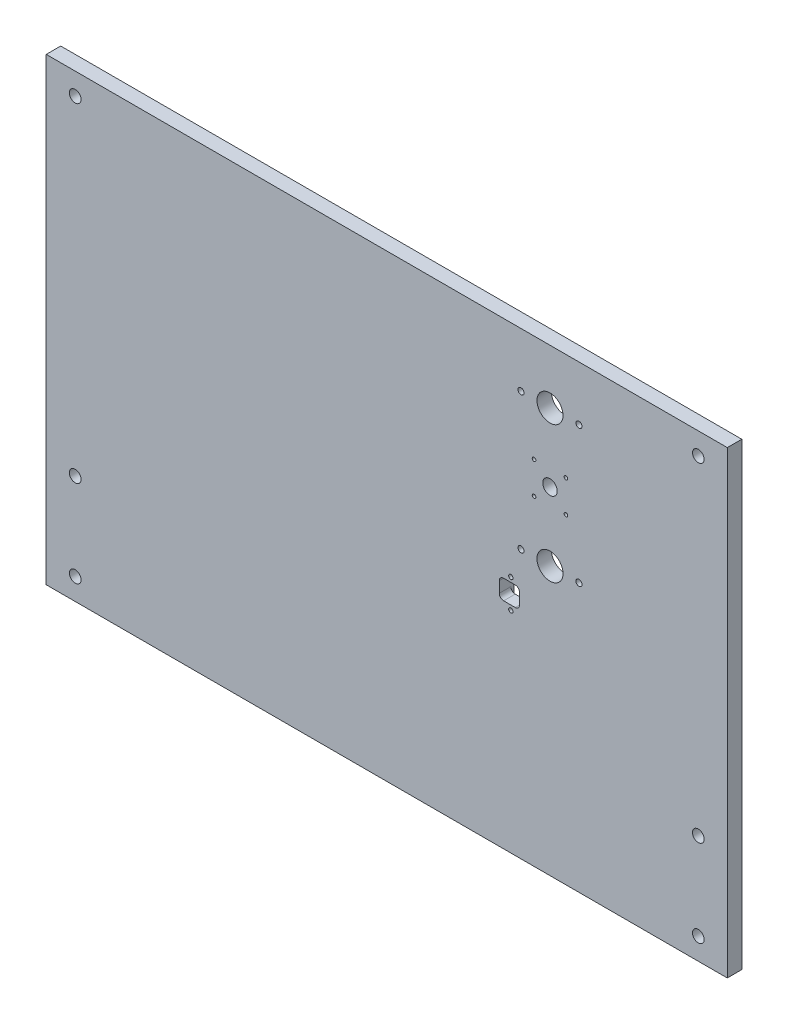
from build123d import *

# Parameters (mm, degrees)
SKETCH2_W             = 470
SKETCH2_H             = 317
BOSS_EXTRUDE1_DEPTH   = 5
SKETCH3_R             = 4.05
CUT_EXTRUDE1_DEPTH    = 10
SKETCH4_R             = 9
CUT_EXTRUDE2_DEPTH    = 284.632244288
M5X0_8_TAPPED_HOLE1_D = 4.2
SKETCH10_R            = 4
CUT_EXTRUDE8_DEPTH    = 284.632244288
SKETCH11_R            = 5
CUT_EXTRUDE9_DEPTH    = 284.632244288
M3X0_5_TAPPED_HOLE1_D = 2.5
SKETCH20_W            = 14
SKETCH20_H            = 30
CUT_EXTRUDE11_DEPTH   = 2
SKETCH22_R            = 1.5
CUT_EXTRUDE12_DEPTH   = 284.568774727
SKETCH23_W            = 14
SKETCH23_H            = 13.5
CUT_EXTRUDE13_DEPTH   = 284.568774727
FILLET1_R             = 3


with BuildPart() as part:
    # Sketch2 → Boss-Extrude1 (new, symmetric)
    with BuildSketch(Plane.XY):
        Rectangle(SKETCH2_W, SKETCH2_H)
    extrude(amount=BOSS_EXTRUDE1_DEPTH, both=True)

    # Sketch3 → Cut-Extrude1 (cut)
    with BuildSketch(Plane.XY.offset(5)):
        with Locations((-215, -83.5)):
            Circle(SKETCH3_R)
        with Locations((-215, -143.5)):
            Circle(SKETCH3_R)
        with Locations((215, -83.5)):
            Circle(SKETCH3_R)
        with Locations((215, -143.5)):
            Circle(SKETCH3_R)
        with Locations((-215, 143.5)):
            Circle(SKETCH3_R)
    extrude(amount=-CUT_EXTRUDE1_DEPTH, mode=Mode.SUBTRACT)

    # Sketch4 → Cut-Extrude2 (cut, through all)
    with BuildSketch(Plane.XY.offset(5)):
        with Locations((112.65, 121)):
            Circle(SKETCH4_R)
        with Locations((112.65, 26.5)):
            Circle(SKETCH4_R)
    extrude(amount=-CUT_EXTRUDE2_DEPTH, mode=Mode.SUBTRACT)

    # M5x0.8 Tapped Hole1 (through all)
    with Locations(Plane.XY.offset(5)):
        with Locations((132.65, 121), (92.65, 121), (92.65, 26.5), (132.65, 26.5)):
            Hole(M5X0_8_TAPPED_HOLE1_D / 2)

    # Sketch10 → Cut-Extrude8 (cut, through all)
    with BuildSketch(Plane.XY.offset(5)):
        with Locations((215, 143.5)):
            Circle(SKETCH10_R)
    extrude(amount=-CUT_EXTRUDE8_DEPTH, mode=Mode.SUBTRACT)

    # Sketch11 → Cut-Extrude9 (cut, through all)
    with BuildSketch(Plane.XY.offset(5)):
        with Locations((112.65, 73.75)):
            Circle(SKETCH11_R)
    extrude(amount=-CUT_EXTRUDE9_DEPTH, mode=Mode.SUBTRACT)

    # M3x0.5 Tapped Hole1 (through all)
    with Locations(Plane.XY.offset(5)):
        with Locations((101.65, 84.75), (123.65, 84.75), (123.65, 62.75), (101.65, 62.75)):
            Hole(M3X0_5_TAPPED_HOLE1_D / 2)

    # Sketch20 → Cut-Extrude11 (cut)
    with BuildSketch(Plane.XY.offset(-5)):
        with Locations((84.65, -3.5)):
            Rectangle(SKETCH20_W, SKETCH20_H)
    extrude(amount=CUT_EXTRUDE11_DEPTH, mode=Mode.SUBTRACT)

    # Sketch22 → Cut-Extrude12 (cut, through all)
    with BuildSketch(Plane(origin=(0, 0, -3), x_dir=(-1, 0, 0), z_dir=(0, 0, -1))):
        with Locations((-85.65, 6.5)):
            Circle(SKETCH22_R)
        with Locations((-85.65, -13.5)):
            Circle(SKETCH22_R)
    extrude(amount=-CUT_EXTRUDE12_DEPTH, mode=Mode.SUBTRACT)

    # Sketch23 → Cut-Extrude13 (cut, through all)
    with BuildSketch(Plane(origin=(0, 0, -3), x_dir=(-1, 0, 0), z_dir=(0, 0, -1))):
        with Locations((-84.65, -3.5)):
            Rectangle(SKETCH23_W, SKETCH23_H)
    extrude(amount=-CUT_EXTRUDE13_DEPTH, mode=Mode.SUBTRACT)

    # Fillet1
    fillet1_edges = [part.edges().sort_by_distance(p)[0] for p in [
        (91.65, -18.5, -4),
        (77.65, -18.5, -4),
        (77.65, 11.5, -4),
        (91.65, 11.5, -4),
        (77.65, -10.25, 1),
        (77.65, 3.25, 1),
        (91.65, 3.25, 1),
        (91.65, -10.25, 1),
    ]]
    fillet(fillet1_edges, radius=FILLET1_R)


solid = part.part
